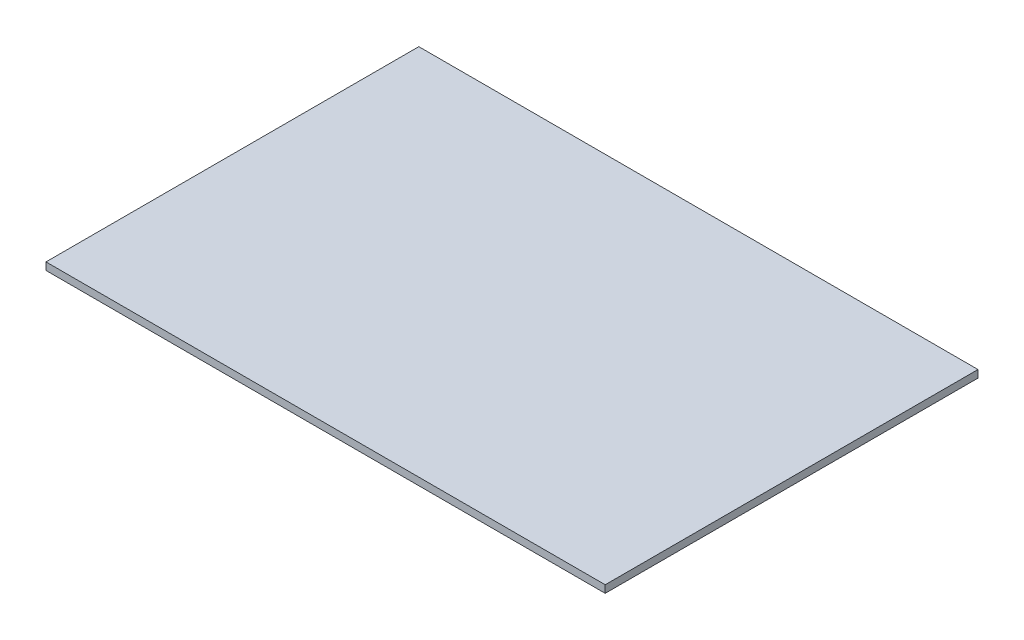
from build123d import *

# Parameters (mm, degrees)
SKETCH1_W           = 300
SKETCH1_H           = 200
BOSS_EXTRUDE1_DEPTH = 4


with BuildPart() as part:
    # Sketch1 → Boss-Extrude1 (new body)
    with BuildSketch(Plane(origin=(0, 0, 0), x_dir=(1, 0, 0), z_dir=(0, 1, 0))):
        with Locations((250, 105.323868678)):
            Rectangle(SKETCH1_W, SKETCH1_H)
    extrude(amount=BOSS_EXTRUDE1_DEPTH)


solid = part.part
